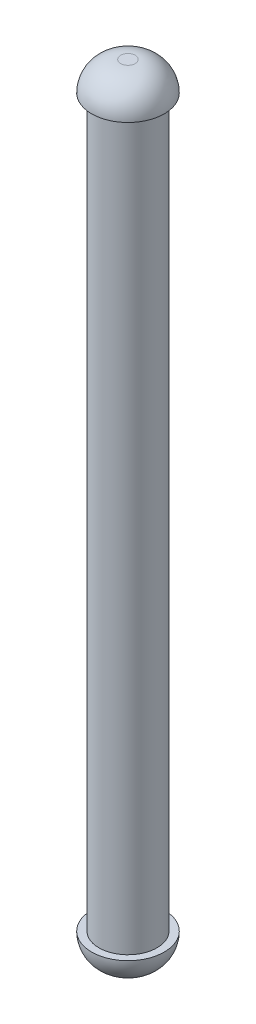
from build123d import *

# Parameters (mm, degrees)
SKETCH1_R           = 1
BOSS_EXTRUDE1_DEPTH = 25
SKETCH2_R           = 1.25
BOSS_EXTRUDE2_DEPTH = 1
FILLET1_R           = 1
BOSS_EXTRUDE5_START = 26
SKETCH3_R           = 1.25
BOSS_EXTRUDE5_DEPTH = 1
FILLET2_R           = 1


with BuildPart() as part:
    # Sketch1 → Boss-Extrude1 (new body)
    with BuildSketch(Plane(origin=(0, 0, 0), x_dir=(1, 0, 0), z_dir=(0, 1, 0))):
        with Locations(Location((0, 0, 0), (0, 0, 270))):
            Circle(SKETCH1_R)
    extrude(amount=BOSS_EXTRUDE1_DEPTH)

    # Sketch2 → Boss-Extrude2 (add)
    with BuildSketch(Plane(origin=(0, 0, 0), x_dir=(1, 0, 0), z_dir=(0, 1, 0))):
        with Locations(Location((0, 0, 0), (0, 0, 270))):
            Circle(SKETCH2_R)
    extrude(amount=-BOSS_EXTRUDE2_DEPTH)

    # Fillet1
    fillet1_edges = [part.edges().sort_by_distance(p)[0] for p in [
        (0, -1, -1.25),
    ]]
    fillet(fillet1_edges, radius=FILLET1_R - 0.0001)  # a hair under: the kernel refuses the full size

    # Sketch3 → Boss-Extrude5 (add)
    with BuildSketch(Plane(origin=(0, 0, 0), x_dir=(1, 0, 0), z_dir=(0, 1, 0)).offset(BOSS_EXTRUDE5_START)):
        with Locations(Location((0, 0, 0), (0, 0, 270))):
            Circle(SKETCH3_R)
    extrude(amount=-BOSS_EXTRUDE5_DEPTH)

    # Fillet2
    fillet2_edges = [part.edges().sort_by_distance(p)[0] for p in [
        (0, 26, -1.25),
    ]]
    fillet(fillet2_edges, radius=FILLET2_R - 0.0001)  # a hair under: the kernel refuses the full size


solid = part.part
